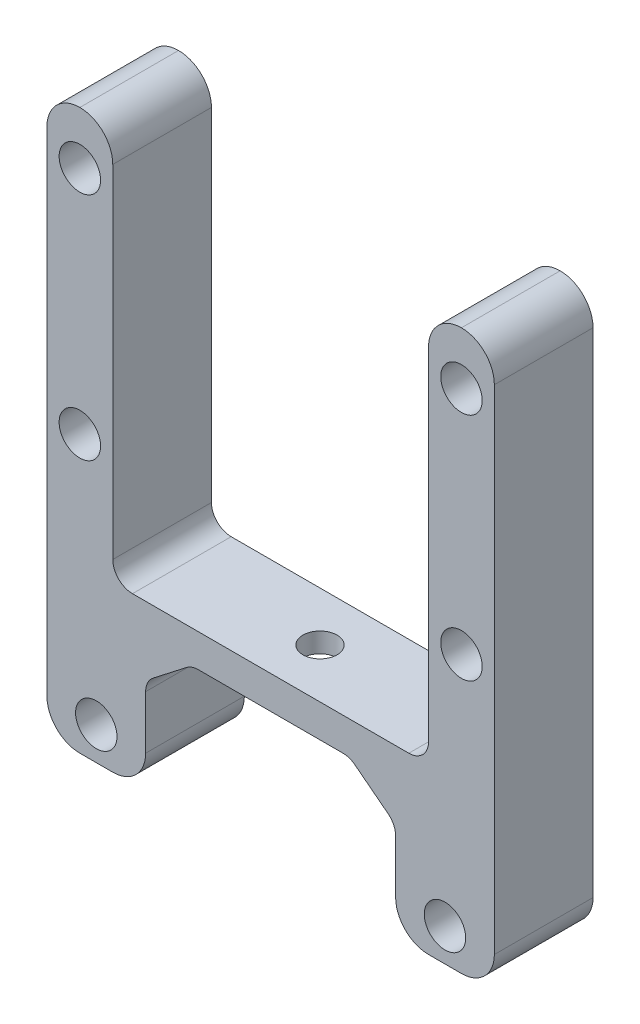
from build123d import *

# Parameters (mm, degrees)
ESQUISSE1_R             = 3.15
BOSS_EXTRU_1_DEPTH      = 15
CONG_1_R                = 3
CONG_2_R                = 5
CONG_1_OF_SYM_TRIE2_R   = 3
CONG_2_OF_SYM_TRIE2_R   = 5
ESQUISSE3_R             = 5.75
ENL_V_MAT_EXTRU_1_DEPTH = 2
ENL_V_MAT_EXTRU_2_REACH = 75.144
ESQUISSE4_R             = 2.6


with BuildPart() as part:
    # Esquisse1 → Boss.-Extru.1 (new body)
    with BuildSketch(Plane.XY):
        Polygon((0, 0), (0, 5), (24, 5), (24, 65), (34, 65), (34, -20), (19, -20), (19, -5.425258757), (12, 0), align=None)
        with Locations((29, 57)):
            Circle(ESQUISSE1_R, mode=Mode.SUBTRACT)
        with Locations((26.5, -15)):
            Circle(ESQUISSE1_R, mode=Mode.SUBTRACT)
        with Locations((29, 22)):
            Circle(ESQUISSE1_R, mode=Mode.SUBTRACT)
    boss_extru_1 = extrude(amount=BOSS_EXTRU_1_DEPTH)

    # Congé1
    cong_1_edges = [part.edges().sort_by_distance(p)[0] for p in [
        (24, 5, 7.5),
        (19, -5.425258757, 7.5),
        (12, 0, 7.5),
    ]]
    fillet(cong_1_edges, radius=CONG_1_R)

    # Congé2
    cong_2_edges = [part.edges().sort_by_distance(p)[0] for p in [
        (19, -20, 7.5),
        (34, -20, 7.5),
        (24, 65, 7.5),
        (34, 65, 7.5),
    ]]
    fillet(cong_2_edges, radius=CONG_2_R - 0.0001)  # a hair under: the kernel refuses the full size

    # Symétrie2: Boss.-Extru.1 across plane
    add(boss_extru_1.mirror(Plane(origin=(0, 0, 15), x_dir=(0, 0, 1), z_dir=(1, 0, 0))))

    # Congé1 of Symétrie2
    cong_1_of_sym_trie2_edges = [part.edges().sort_by_distance(p)[0] for p in [
        (-24, 5, 7.5),
        (-19, -5.425258757, 7.5),
        (-12, 0, 7.5),
    ]]
    fillet(cong_1_of_sym_trie2_edges, radius=CONG_1_OF_SYM_TRIE2_R)

    # Congé2 of Symétrie2
    cong_2_of_sym_trie2_edges = [part.edges().sort_by_distance(p)[0] for p in [
        (-19, -20, 7.5),
        (-34, -20, 7.5),
        (-24, 65, 7.5),
        (-34, 65, 7.5),
    ]]
    fillet(cong_2_of_sym_trie2_edges, radius=CONG_2_OF_SYM_TRIE2_R - 0.0001)  # a hair under: the kernel refuses the full size

    # Esquisse3 → Enlèv. mat.-Extru.1 (cut)
    with BuildSketch(Plane.XZ):
        with Locations(Location((0, 7.5, 0), (0, 0, 270))):
            Circle(ESQUISSE3_R)
    extrude(amount=-ENL_V_MAT_EXTRU_1_DEPTH, mode=Mode.SUBTRACT)

    # Esquisse4 → Enlèv. mat.-Extru.2 (cut, up to next)
    with BuildSketch(Plane.XZ.offset(-2), mode=Mode.PRIVATE) as enl_v_mat_extru_2_sk1:
        with Locations(Location((0, 7.5, 0), (0, 0, 270))):
            Circle(ESQUISSE4_R)
    enl_v_mat_extru_2_tool1 = extrude(enl_v_mat_extru_2_sk1.sketch, amount=-ENL_V_MAT_EXTRU_2_REACH, mode=Mode.PRIVATE) & part.part
    enl_v_mat_extru_2 = enl_v_mat_extru_2_tool1.solids().sort_by_distance((0, 2, 7.5))[0]
    add(enl_v_mat_extru_2, mode=Mode.SUBTRACT)

    # Symétrie1: Enlèv. mat.-Extru.2 across Right Plane
    add(enl_v_mat_extru_2.mirror(Plane(origin=(0, 0, 0), x_dir=(0, 0, -1), z_dir=(1, 0, 0))), mode=Mode.SUBTRACT)


solid = part.part
